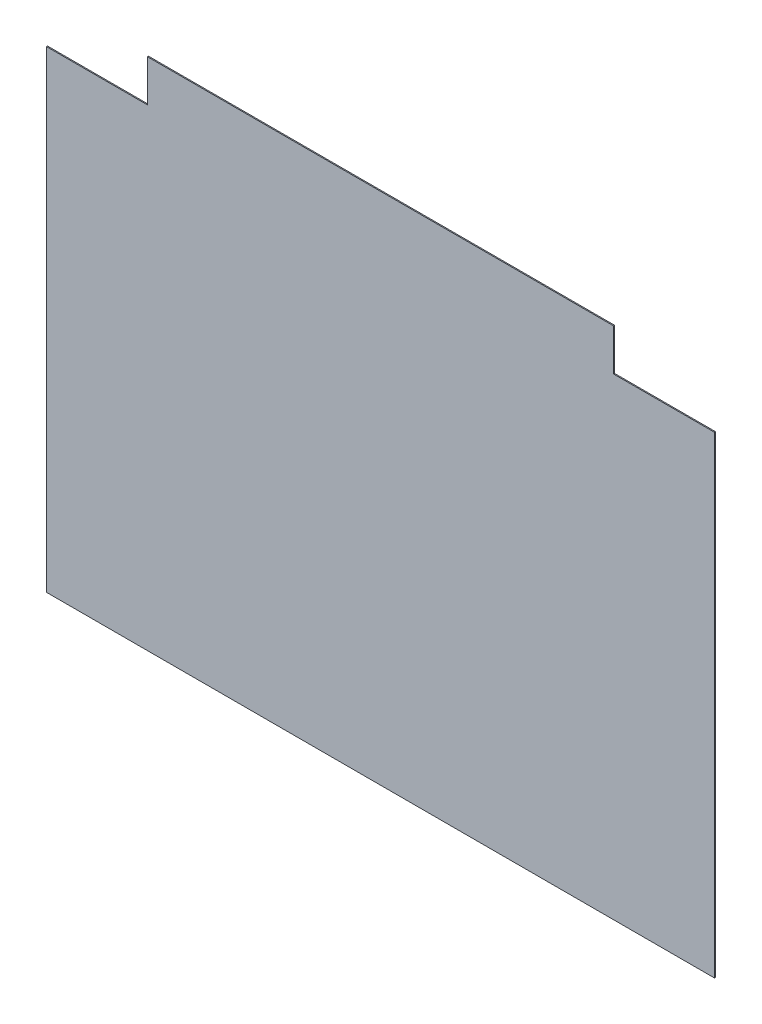
from build123d import *

# Parameters (mm, degrees)
SKETCH1_W          = 961
SKETCH1_H          = 740
BASE_FLANGE1_DEPTH = 1.5
CUT_EXTRUDE1_REACH = 884.317
SKETCH2_W          = 145
SKETCH2_H          = 60


# Sheet-metal steps are written as plain solids
with BuildPart() as part:
    # Sketch1 → Base-Flange1 (new body)
    with BuildSketch(Plane.XY):
        with Locations((0, 370)):
            Rectangle(SKETCH1_W, SKETCH1_H)
    extrude(amount=-BASE_FLANGE1_DEPTH)

    # Sketch2 → Cut-Extrude1 (cut, up to next)
    with BuildSketch(Plane.XY, mode=Mode.PRIVATE) as cut_extrude1_sk1:
        with Locations((-408, 710)):
            Rectangle(SKETCH2_W, SKETCH2_H)
    cut_extrude1_tool1 = extrude(cut_extrude1_sk1.sketch, amount=-CUT_EXTRUDE1_REACH, mode=Mode.PRIVATE) & part.part
    cut_extrude1 = cut_extrude1_tool1.solids().sort_by_distance((-408, 710, 0))[0]
    add(cut_extrude1, mode=Mode.SUBTRACT)

    # Mirror1: Cut-Extrude1 across plane
    add(cut_extrude1.mirror(Plane(origin=(0, 0, 0), x_dir=(0, 0, 1), z_dir=(1, 0, 0))), mode=Mode.SUBTRACT)


solid = part.part
